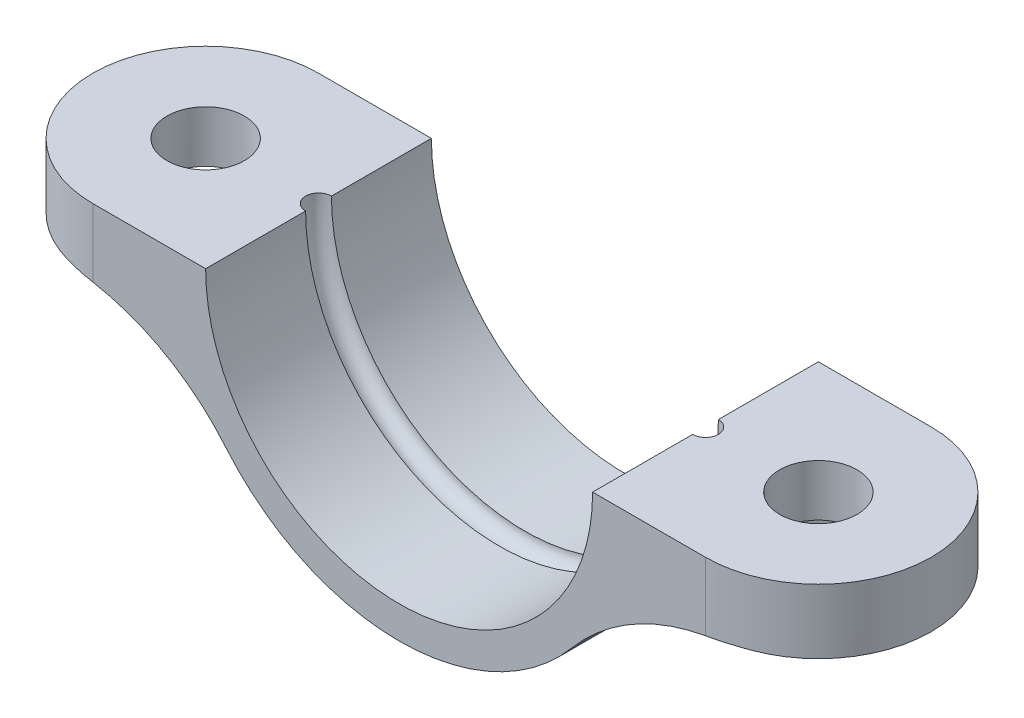
from build123d import *

# Parameters (mm, degrees)
BOSS_EXTRUDE1_DEPTH = 17.5
SKETCH2_R           = 6
CUT_EXTRUDE1_DEPTH  = 35
CUT_EXTRUDE2_START  = -8
SKETCH3_R           = 10
CUT_EXTRUDE2_DEPTH  = 35
SKETCH4_R           = 2
FILLET1_START       = -35
FILLET1_DEPTH       = 35
FILLET2_START       = -35
FILLET2_DEPTH       = 35


with BuildPart() as part:
    # Sketch1 → Boss-Extrude1 (new, symmetric)
    with BuildSketch(Plane.XY):
        with BuildLine():
            Line((30, 0), (65, 0))
            Line((65, 0), (65, -10))
            Line((65, -10), (53.619026474, -10))
            ThreePointArc((53.619026474, -10), (38.828827016, -13.278556149), (26.809513237, -22.5))
            ThreePointArc((26.809513237, -22.5), (0, -35), (-26.809513237, -22.5))
            ThreePointArc((-26.809513237, -22.5), (-38.828827016, -13.278556149), (-53.619026474, -10))
            Line((-53.619026474, -10), (-65, -10))
            Line((-65, -10), (-65, 0))
            Line((-65, 0), (-30, 0))
            ThreePointArc((-30, 0), (0, -30), (30, 0))
        make_face()
    extrude(amount=BOSS_EXTRUDE1_DEPTH, both=True)

    # Sketch2 → Cut-Extrude1 (cut)
    with BuildSketch(Plane(origin=(0, 0, 0), x_dir=(1, 0, 0), z_dir=(0, 1, 0))):
        with Locations(Location((47.5, 0, 0), (0, 0, 270))):
            Circle(SKETCH2_R)
        with Locations(Location((-47.5, 0, 0), (0, 0, 270))):
            Circle(SKETCH2_R)
    extrude(amount=-CUT_EXTRUDE1_DEPTH, mode=Mode.SUBTRACT)

    # Sketch3 → Cut-Extrude2 (cut)
    with BuildSketch(Plane(origin=(0, 0, 0), x_dir=(1, 0, 0), z_dir=(0, 1, 0)).offset(CUT_EXTRUDE2_START)):
        with Locations(Location((-47.5, 0, 0), (0, 0, 270))):
            Circle(SKETCH3_R)
        with Locations(Location((47.5, 0, 0), (0, 0, 270))):
            Circle(SKETCH3_R)
    extrude(amount=-CUT_EXTRUDE2_DEPTH, mode=Mode.SUBTRACT)

    # Sketch4 → Cut-Revolve1 (revolve, cut)
    with BuildSketch(Plane(origin=(0, 0, 0), x_dir=(1, 0, 0), z_dir=(0, 1, 0))):
        with Locations((30, 0)):
            Circle(SKETCH4_R)
    revolve(axis=Axis((0, 0, 0), (0, 0, -1)), mode=Mode.SUBTRACT)

    # Fillet1: read off the stored shape, not the designer's step
    # Fillet1 outline → Fillet1 (cut)
    with BuildSketch(Plane(origin=(0, 0, 0), x_dir=(1, 0, 0), z_dir=(0, 1, 0)).offset(FILLET1_START)):
        with BuildLine():
            Line((-65, -17.5), (-47.5, -17.5))
            ThreePointArc((-47.5, -17.5), (-59.874368665, -12.374368677), (-65, -1.8e-08))
            Line((-65, -1.8e-08), (-65, -17.5))
        make_face()
        with BuildLine():
            Line((-65, 17.5), (-65, -1.8e-08))
            ThreePointArc((-65, -1.8e-08), (-59.874368677, 12.374368665), (-47.5, 17.5))
            Line((-47.5, 17.5), (-65, 17.5))
        make_face()
    extrude(amount=FILLET1_DEPTH, mode=Mode.SUBTRACT)

    # Fillet2: read off the stored shape, not the designer's step
    # Fillet2 outline → Fillet2 (cut)
    with BuildSketch(Plane(origin=(0, 0, 0), x_dir=(1, 0, 0), z_dir=(0, 1, 0)).offset(FILLET2_START)):
        with BuildLine():
            ThreePointArc((47.499999999, 17.5), (59.874368745, 12.374368596), (64.999999999, -2.12e-07))
            Line((64.999999999, -2.12e-07), (65, 17.5))
            Line((65, 17.5), (47.499999999, 17.5))
        make_face()
        with BuildLine():
            ThreePointArc((64.999999999, -2.12e-07), (59.874368595, -12.374368746), (47.499999999, -17.5))
            Line((47.499999999, -17.5), (65, -17.5))
            Line((65, -17.5), (64.999999999, -2.12e-07))
        make_face()
    extrude(amount=FILLET2_DEPTH, mode=Mode.SUBTRACT)


solid = part.part
